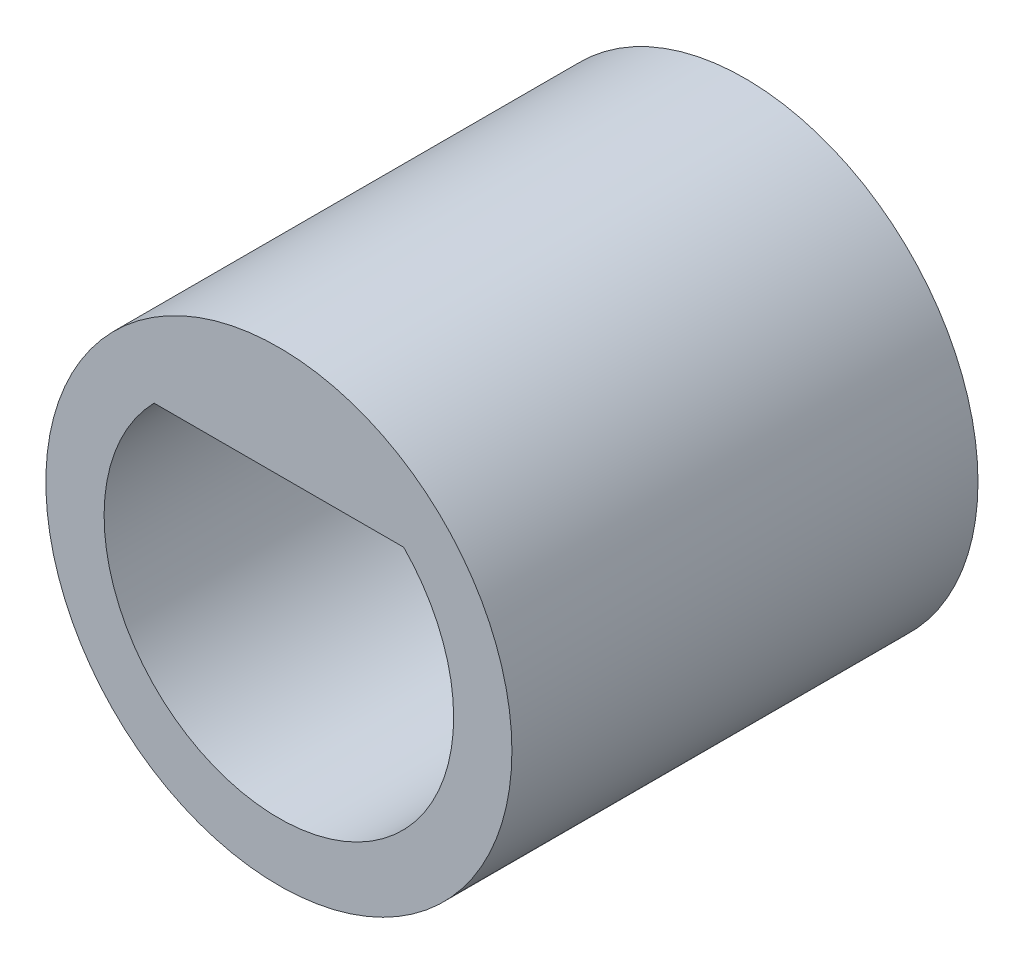
from build123d import *

# Parameters (mm, degrees)
ESQUISSE1_R        = 4
BOSS_EXTRU_1_DEPTH = 8


with BuildPart() as part:
    # Esquisse1 → Boss.-Extru.1 (new body)
    with BuildSketch(Plane.XY):
        Circle(ESQUISSE1_R)
        with BuildLine():
            Line((-2.142428529, 2.1), (2.142428529, 2.1))
            ThreePointArc((2.142428529, 2.1), (0, -3), (-2.142428529, 2.1))
        make_face(mode=Mode.SUBTRACT)
    extrude(amount=BOSS_EXTRU_1_DEPTH)


solid = part.part
